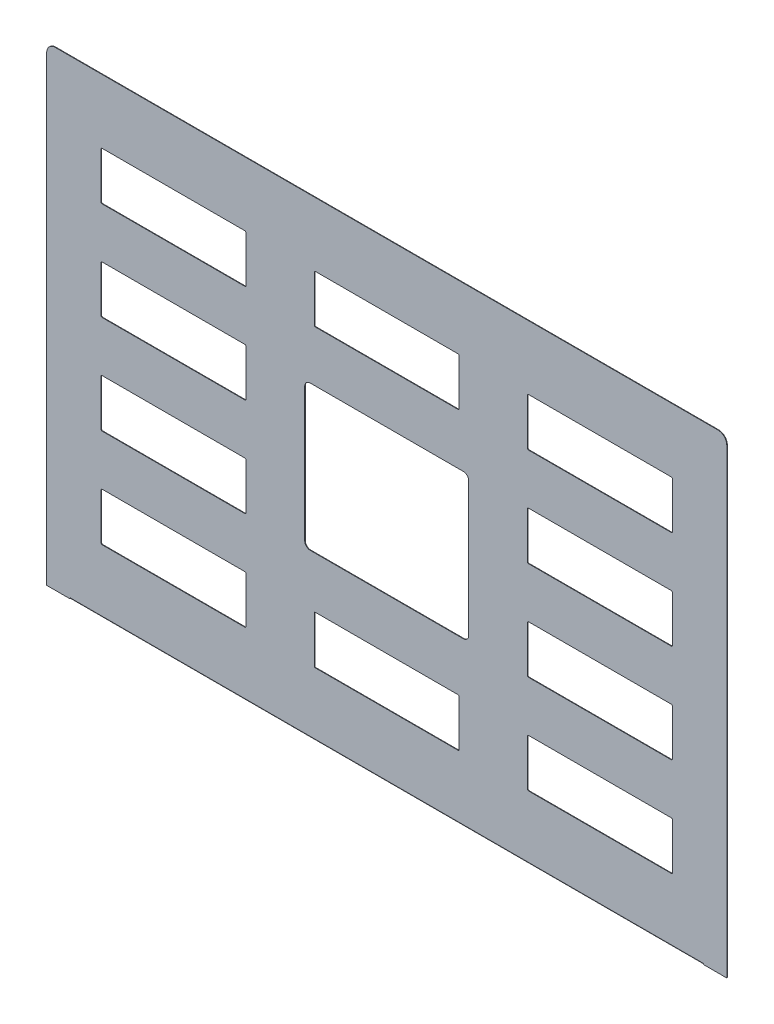
from build123d import *

# Parameters (mm, degrees)
BASE_FLANGE1_DEPTH            = 1
EDGE_FLANGE1_STRIP_W          = 6
EDGE_FLANGE1_STRIP_H          = 1
EDGE_FLANGE1_STRIP_CUT_DEPTH  = 1158
EDGE_FLANGE1_RELIEF_W         = 6.5
EDGE_FLANGE1_RELIEF_H         = 0.5
EDGE_FLANGE1_RELIEF_CUT_DEPTH = 1
EDGE_FLANGE1_DEPTH            = 1158
EDGE_FLANGE1_PROFILE_W        = 1158
EDGE_FLANGE1_PROFILE_H        = 17
EDGE_FLANGE1_PROFILE_R        = 2.75
EDGE_FLANGE1_FLAT_DEPTH       = 1
CUT_EXTRUDE1_DEPTH            = 10
CUT_EXTRUDE2_DEPTH            = 10


# Sheet-metal steps are written as plain solids
with BuildPart() as part:
    # Sketch1 → Base-Flange1 (new body)
    with BuildSketch(Plane.XY):
        with BuildLine():
            Line((0, 0), (1244, 0))
            Line((1244, 0), (1244, 844))
            ThreePointArc((1244, 844), (1239.313708499, 855.313708499), (1228, 860))
            Line((1228, 860), (16, 860))
            ThreePointArc((16, 860), (4.686291501, 855.313708499), (0, 844))
            Line((0, 844), (0, 0))
        make_face()
    extrude(amount=-BASE_FLANGE1_DEPTH)

    # Edge-Flange1 strip (across the edge) → Edge-Flange1 strip cut (cut)
    with BuildSketch(Plane(origin=(1201, 0, -1), x_dir=(0, 1, 0), z_dir=(-1, 0, 0))):
        with Locations((-1, -0.5)):
            Rectangle(EDGE_FLANGE1_STRIP_W, EDGE_FLANGE1_STRIP_H)
    extrude(amount=EDGE_FLANGE1_STRIP_CUT_DEPTH, mode=Mode.SUBTRACT)

    # Edge-Flange1 relief (on the sheet) → Edge-Flange1 relief cut (cut)
    with BuildSketch(Plane(origin=(1201, 2, -1), x_dir=(0, 1, 0), z_dir=(0, 0, -1))):
        with Locations((-2.75, 0.25)):
            Rectangle(EDGE_FLANGE1_RELIEF_W, EDGE_FLANGE1_RELIEF_H)
        with Locations((-2.75, -1158.25)):
            Rectangle(EDGE_FLANGE1_RELIEF_W, EDGE_FLANGE1_RELIEF_H)
    extrude(amount=-EDGE_FLANGE1_RELIEF_CUT_DEPTH, mode=Mode.SUBTRACT)

    # Edge-Flange1 bend section (across the edge) → Edge-Flange1 (add)
    with BuildSketch(Plane(origin=(1201, 0, -1), x_dir=(0, 1, 0), z_dir=(-1, 0, 0))):
        with BuildLine():
            Line((0, 1), (1, 1))
            ThreePointArc((1, 1), (1.292893219, 0.292893219), (2, 0))
            Line((2, 0), (2, -1))
            ThreePointArc((2, -1), (0.585786438, -0.414213562), (0, 1))
        make_face()
    extrude(amount=EDGE_FLANGE1_DEPTH)

    # Edge-Flange1 profile (on flange) → Edge-Flange1 flat (add)
    with BuildSketch(Plane(origin=(0, 0, -1), x_dir=(-1, 0, 0), z_dir=(0, -1, 0))):
        with Locations((-622, 9.5)):
            Rectangle(EDGE_FLANGE1_PROFILE_W, EDGE_FLANGE1_PROFILE_H)
        with Locations((-622, 9)):
            Circle(EDGE_FLANGE1_PROFILE_R, mode=Mode.SUBTRACT)
        with Locations((-802, 9)):
            Circle(EDGE_FLANGE1_PROFILE_R, mode=Mode.SUBTRACT)
        with Locations((-982, 9)):
            Circle(EDGE_FLANGE1_PROFILE_R, mode=Mode.SUBTRACT)
        with Locations((-1162, 9)):
            Circle(EDGE_FLANGE1_PROFILE_R, mode=Mode.SUBTRACT)
        with Locations((-82, 9)):
            Circle(EDGE_FLANGE1_PROFILE_R, mode=Mode.SUBTRACT)
        with Locations((-262, 9)):
            Circle(EDGE_FLANGE1_PROFILE_R, mode=Mode.SUBTRACT)
        with Locations((-442, 9)):
            Circle(EDGE_FLANGE1_PROFILE_R, mode=Mode.SUBTRACT)
    extrude(amount=-EDGE_FLANGE1_FLAT_DEPTH)

    # Sketch9 → Cut-Extrude1 (cut)
    with BuildSketch(Plane.XY):
        with BuildLine():
            Line((1142.5, 743), (881.5, 743))
            ThreePointArc((881.5, 743), (880.085786438, 742.414213562), (879.5, 741))
            Line((879.5, 741), (879.5, 657))
            ThreePointArc((879.5, 657), (880.085786438, 655.585786438), (881.5, 655))
            Line((881.5, 655), (1142.5, 655))
            ThreePointArc((1142.5, 655), (1143.914213562, 655.585786438), (1144.5, 657))
            Line((1144.5, 657), (1144.5, 741))
            ThreePointArc((1144.5, 741), (1143.914213562, 742.414213562), (1142.5, 743))
        make_face()
        with BuildLine():
            Line((754.5, 741), (754.5, 657))
            ThreePointArc((754.5, 657), (753.914213562, 655.585786438), (752.5, 655))
            Line((752.5, 655), (491.5, 655))
            ThreePointArc((491.5, 655), (490.085786438, 655.585786438), (489.5, 657))
            Line((489.5, 657), (489.5, 741))
            ThreePointArc((489.5, 741), (490.085786438, 742.414213562), (491.5, 743))
            Line((491.5, 743), (752.5, 743))
            ThreePointArc((752.5, 743), (753.914213562, 742.414213562), (754.5, 741))
        make_face()
        with BuildLine():
            Line((364.5, 741), (364.5, 657))
            ThreePointArc((364.5, 657), (363.914213562, 655.585786438), (362.5, 655))
            Line((362.5, 655), (101.5, 655))
            ThreePointArc((101.5, 655), (100.085786438, 655.585786438), (99.5, 657))
            Line((99.5, 657), (99.5, 741))
            ThreePointArc((99.5, 741), (100.085786438, 742.414213562), (101.5, 743))
            Line((101.5, 743), (362.5, 743))
            ThreePointArc((362.5, 743), (363.914213562, 742.414213562), (364.5, 741))
        make_face()
        with BuildLine():
            Line((364.5, 561), (364.5, 477))
            ThreePointArc((364.5, 477), (363.914213562, 475.585786438), (362.5, 475))
            Line((362.5, 475), (101.5, 475))
            ThreePointArc((101.5, 475), (100.085786438, 475.585786438), (99.5, 477))
            Line((99.5, 477), (99.5, 561))
            ThreePointArc((99.5, 561), (100.085786438, 562.414213562), (101.5, 563))
            Line((101.5, 563), (362.5, 563))
            ThreePointArc((362.5, 563), (363.914213562, 562.414213562), (364.5, 561))
        make_face()
        with BuildLine():
            Line((364.5, 381), (364.5, 297))
            ThreePointArc((364.5, 297), (363.914213562, 295.585786438), (362.5, 295))
            Line((362.5, 295), (101.5, 295))
            ThreePointArc((101.5, 295), (100.085786438, 295.585786438), (99.5, 297))
            Line((99.5, 297), (99.5, 381))
            ThreePointArc((99.5, 381), (100.085786438, 382.414213562), (101.5, 383))
            Line((101.5, 383), (362.5, 383))
            ThreePointArc((362.5, 383), (363.914213562, 382.414213562), (364.5, 381))
        make_face()
        with BuildLine():
            Line((754.5, 201), (754.5, 117))
            ThreePointArc((754.5, 117), (753.914213562, 115.585786438), (752.5, 115))
            Line((752.5, 115), (491.5, 115))
            ThreePointArc((491.5, 115), (490.085786438, 115.585786438), (489.5, 117))
            Line((489.5, 117), (489.5, 201))
            ThreePointArc((489.5, 201), (490.085786438, 202.414213562), (491.5, 203))
            Line((491.5, 203), (752.5, 203))
            ThreePointArc((752.5, 203), (753.914213562, 202.414213562), (754.5, 201))
        make_face()
        with BuildLine():
            Line((364.5, 201), (364.5, 117))
            ThreePointArc((364.5, 117), (363.914213562, 115.585786438), (362.5, 115))
            Line((362.5, 115), (101.5, 115))
            ThreePointArc((101.5, 115), (100.085786438, 115.585786438), (99.5, 117))
            Line((99.5, 117), (99.5, 201))
            ThreePointArc((99.5, 201), (100.085786438, 202.414213562), (101.5, 203))
            Line((101.5, 203), (362.5, 203))
            ThreePointArc((362.5, 203), (363.914213562, 202.414213562), (364.5, 201))
        make_face()
        with BuildLine():
            Line((1144.5, 561), (1144.5, 477))
            ThreePointArc((1144.5, 477), (1143.914213562, 475.585786438), (1142.5, 475))
            Line((1142.5, 475), (881.5, 475))
            ThreePointArc((881.5, 475), (880.085786438, 475.585786438), (879.5, 477))
            Line((879.5, 477), (879.5, 561))
            ThreePointArc((879.5, 561), (880.085786438, 562.414213562), (881.5, 563))
            Line((881.5, 563), (1142.5, 563))
            ThreePointArc((1142.5, 563), (1143.914213562, 562.414213562), (1144.5, 561))
        make_face()
        with BuildLine():
            Line((1144.5, 381), (1144.5, 297))
            ThreePointArc((1144.5, 297), (1143.914213562, 295.585786438), (1142.5, 295))
            Line((1142.5, 295), (881.5, 295))
            ThreePointArc((881.5, 295), (880.085786438, 295.585786438), (879.5, 297))
            Line((879.5, 297), (879.5, 381))
            ThreePointArc((879.5, 381), (880.085786438, 382.414213562), (881.5, 383))
            Line((881.5, 383), (1142.5, 383))
            ThreePointArc((1142.5, 383), (1143.914213562, 382.414213562), (1144.5, 381))
        make_face()
        with BuildLine():
            Line((1144.5, 201), (1144.5, 117))
            ThreePointArc((1144.5, 117), (1143.914213562, 115.585786438), (1142.5, 115))
            Line((1142.5, 115), (881.5, 115))
            ThreePointArc((881.5, 115), (880.085786438, 115.585786438), (879.5, 117))
            Line((879.5, 117), (879.5, 201))
            ThreePointArc((879.5, 201), (880.085786438, 202.414213562), (881.5, 203))
            Line((881.5, 203), (1142.5, 203))
            ThreePointArc((1142.5, 203), (1143.914213562, 202.414213562), (1144.5, 201))
        make_face()
    extrude(amount=-CUT_EXTRUDE1_DEPTH, mode=Mode.SUBTRACT)

    # Sketch10 → Cut-Extrude2 (cut)
    with BuildSketch(Plane.XY):
        with BuildLine():
            Line((482, 296.5), (762, 296.5))
            ThreePointArc((762, 296.5), (769.071067812, 299.428932188), (772, 306.5))
            Line((772, 306.5), (772, 551.5))
            ThreePointArc((772, 551.5), (769.071067812, 558.571067812), (762, 561.5))
            Line((762, 561.5), (482, 561.5))
            ThreePointArc((482, 561.5), (474.928932188, 558.571067812), (472, 551.5))
            Line((472, 551.5), (472, 306.5))
            ThreePointArc((472, 306.5), (474.928932188, 299.428932188), (482, 296.5))
        make_face()
    extrude(amount=-CUT_EXTRUDE2_DEPTH, mode=Mode.SUBTRACT)


solid = part.part
